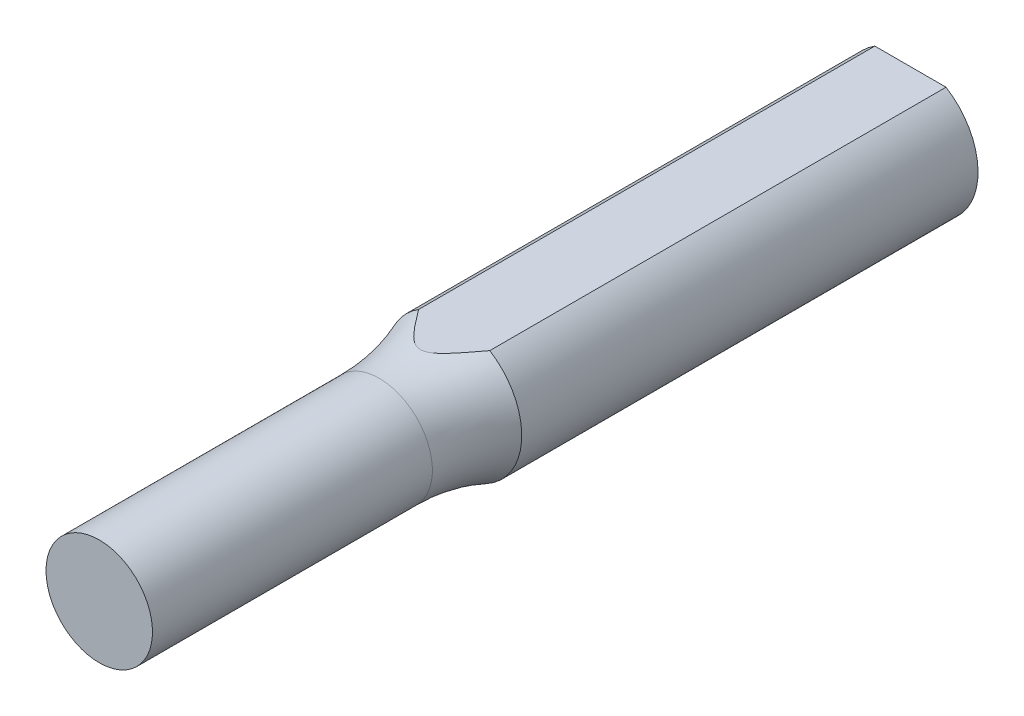
from build123d import *

# Parameters (mm, degrees)
BOSS_EXTRUDE1_DEPTH      = 1
BOSS_EXTRUDE1_DEPTH_BACK = 11
BOSS_EXTRUDE2_DEPTH      = 15
SKETCH3_R                = 3.15
BOSS_EXTRUDE3_DEPTH      = 21
FILLET1_R                = 12


with BuildPart() as part:
    # Sketch1 → Boss-Extrude1 (new, two sides: drawn at the far end of the back side and taken through both)
    with BuildSketch(Plane.XY.offset(-BOSS_EXTRUDE1_DEPTH_BACK)):
        with BuildLine():
            Line((2.107130751, -3.6), (-2.107130751, -3.6))
            ThreePointArc((-2.107130751, -3.6), (-3.494890771, -5.054302567), (-4, -7))
            ThreePointArc((-4, -7), (1.945697433, -10.494890771), (2.107130751, -3.6))
        make_face()
        with BuildLine():
            Line((1.881488772, -4.35), (-1.881488772, -4.35))
            ThreePointArc((-1.881488772, -4.35), (-2.887675407, -5.508748598), (-3.25, -7))
            ThreePointArc((-3.25, -7), (1.491251402, -9.887675407), (1.881488772, -4.35))
        make_face(mode=Mode.SUBTRACT)
    extrude(amount=BOSS_EXTRUDE1_DEPTH + BOSS_EXTRUDE1_DEPTH_BACK)

    # Sketch2 → Boss-Extrude2 (add)
    with BuildSketch(Plane.XY.offset(1)):
        with BuildLine():
            Line((2.107130751, -3.6), (-2.107130751, -3.6))
            ThreePointArc((-2.107130751, -3.6), (0, -11), (2.107130751, -3.6))
        make_face()
    extrude(amount=BOSS_EXTRUDE2_DEPTH)

    # Sketch3 → Boss-Extrude3 (add)
    with BuildSketch(Plane.XY.offset(16)):
        with Locations(Location((0, -7, 0), (0, 0, 180))):
            Circle(SKETCH3_R)
    extrude(amount=BOSS_EXTRUDE3_DEPTH)

    # Fillet1
    # the kernel refuses this fillet: 12 mm, written as the material it adds along each edge
    with BuildSketch(Plane(origin=(0, -7, 16), x_dir=(-1, 0, 0), z_dir=(0, 1, 0))) as fillet1_piece_1_section:
        with BuildLine():
            CenterArc((15.15, 4.435932822), FILLET1_R, 180, 21.694716022)
            Line((3.15, 4.435932822), (2.91, 4.435932822))
            Line((2.91, 4.435932822), (2.91, 0))
            Line((2.91, 0), (3.15, -0.24))
            ThreePointArc((3.15, -0.24), (3.575, -0.24), (3.777, -0.088718656))
            Line((3.777, -0.088718656), (4, 0))
        make_face()
    fillet1_piece_1 = revolve(axis=Axis((0, -7, 16), (0, 0, 1)), mode=Mode.PRIVATE)
    fillet1_piece_1 = split(fillet1_piece_1, bisect_by=Plane(origin=(3.32837519, -3.6, 18.170708912), z_dir=(0, -1, 0)), keep=Keep.TOP, mode=Mode.PRIVATE)
    add(fillet1_piece_1)


solid = part.part
